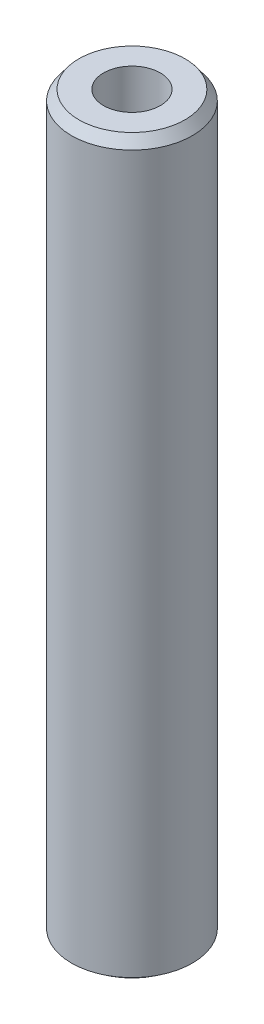
from build123d import *
from OCP.BRepFilletAPI import BRepFilletAPI_MakeChamfer

# Parameters (mm, degrees)
SKETCH1_R           = 25
BOSS_EXTRUDE1_DEPTH = 303.762270211
SKETCH2_R           = 11.745816581
CUT_EXTRUDE1_DEPTH  = 306.812878741
CHAMFER1_SIZE       = 4.141205086
CHAMFER1_SIZE2      = 3.070766144


with BuildPart() as part:
    # Sketch1 → Boss-Extrude1 (new body)
    with BuildSketch(Plane(origin=(0, 0, 0), x_dir=(1, 0, 0), z_dir=(0, 1, 0))):
        Circle(SKETCH1_R)
    extrude(amount=BOSS_EXTRUDE1_DEPTH)

    # Sketch2 → Cut-Extrude1 (cut, through all)
    with BuildSketch(Plane(origin=(0, 0, 0), x_dir=(1, 0, 0), z_dir=(0, 1, 0))):
        Circle(SKETCH2_R)
    extrude(amount=CUT_EXTRUDE1_DEPTH, mode=Mode.SUBTRACT)

    # Chamfer1: one chamfer whose edges measure the first distance from different faces: ONE call of the kernel's chamfer builder (chamfer() names one face for all edges)
    chamfer1_edges_1 = [part.edges().sort_by_distance(p)[0] for p in [
        (-25, 303.762270211, 0),
    ]]
    chamfer1_side_1 = [part.faces().sort_by_distance(p)[0] for p in [
        (-25, 151.881135106, 0),
    ]]
    chamfer1_edges_2 = [part.edges().sort_by_distance(p)[0] for p in [
        (-25, 0, 0),
    ]]
    chamfer1_side_2 = [part.faces().sort_by_distance(p)[0] for p in [
        (-24.292893219, 0, 0),
    ]]
    chamfer1 = BRepFilletAPI_MakeChamfer(part.part.solid().wrapped)
    for e in chamfer1_edges_1:
        chamfer1.Add(CHAMFER1_SIZE, CHAMFER1_SIZE2, e.wrapped, chamfer1_side_1[0].wrapped)  # the first distance lies on this face
    for e in chamfer1_edges_2:
        chamfer1.Add(CHAMFER1_SIZE, CHAMFER1_SIZE2, e.wrapped, chamfer1_side_2[0].wrapped)  # the first distance lies on this face
    add(Compound.cast(chamfer1.Shape()), mode=Mode.REPLACE)


solid = part.part
